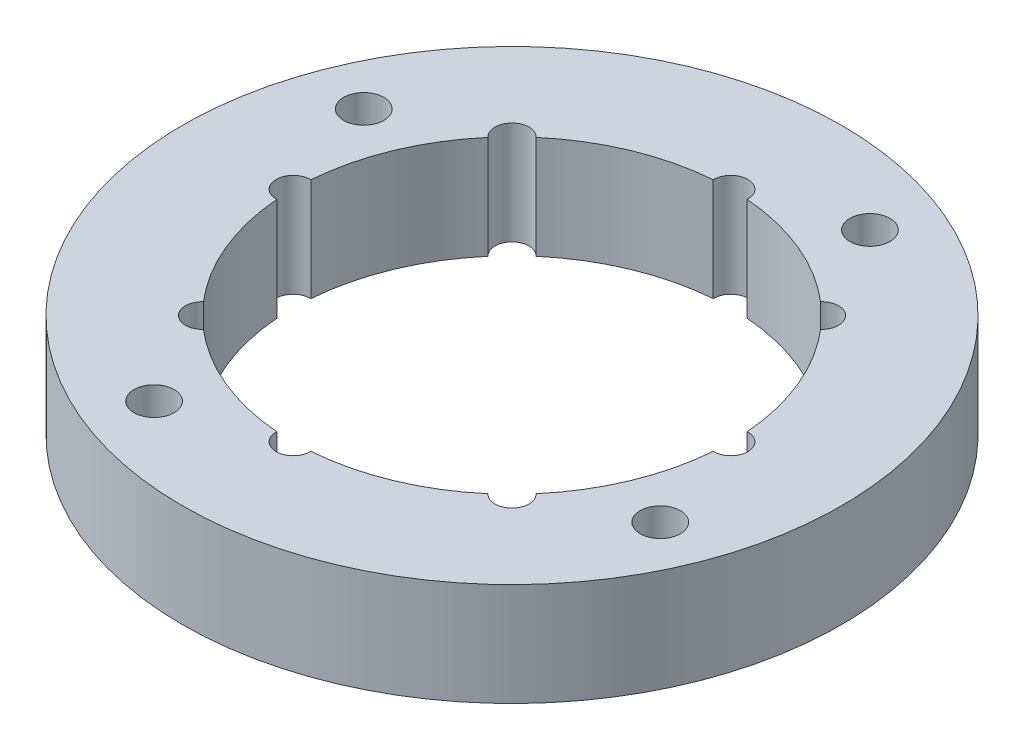
from build123d import *

# Parameters (mm, degrees)
F_1_5IN_SOCKET_R    = 40.64
F_1_5IN_SOCKET_R_2  = 2.475
BOSS_EXTRUDE1_DEPTH = 12.7


with BuildPart() as part:
    # 1.5in Socket → Boss-Extrude1 (new body)
    with BuildSketch(Plane(origin=(0, 0, 0), x_dir=(1, 0, 0), z_dir=(0, 1, 0))):
        Circle(F_1_5IN_SOCKET_R)
        with Locations((-12.927811712, -31.210498367)):
            Circle(F_1_5IN_SOCKET_R_2, mode=Mode.SUBTRACT)
        with BuildLine():
            ThreePointArc((-17.544892644, 20.506142942), (-10.327669131, 24.933198884), (-2.093920166, 26.906145294))
            ThreePointArc((-2.093920166, 26.906145294), (0, 29.083), (2.093920166, 26.906145294))
            ThreePointArc((2.093920166, 26.906145294), (10.327669131, 24.933198884), (17.544892644, 20.506142942))
            ThreePointArc((17.544892644, 20.506142942), (20.564786517, 20.564786517), (20.506142942, 17.544892644))
            ThreePointArc((20.506142942, 17.544892644), (24.933198884, 10.327669131), (26.906145294, 2.093920166))
            ThreePointArc((26.906145294, 2.093920166), (29.083, 0), (26.906145294, -2.093920166))
            ThreePointArc((26.906145294, -2.093920166), (24.933198884, -10.327669131), (20.506142942, -17.544892644))
            ThreePointArc((20.506142942, -17.544892644), (20.564786517, -20.564786517), (17.544892644, -20.506142942))
            ThreePointArc((17.544892644, -20.506142942), (10.327669131, -24.933198884), (2.093920166, -26.906145294))
            ThreePointArc((2.093920166, -26.906145294), (0, -29.083), (-2.093920166, -26.906145294))
            ThreePointArc((-2.093920166, -26.906145294), (-10.327669131, -24.933198884), (-17.544892644, -20.506142942))
            ThreePointArc((-17.544892644, -20.506142942), (-20.564786517, -20.564786517), (-20.506142942, -17.544892644))
            ThreePointArc((-20.506142942, -17.544892644), (-24.933198884, -10.327669131), (-26.906145294, -2.093920166))
            ThreePointArc((-26.906145294, -2.093920166), (-29.083, 0), (-26.906145294, 2.093920166))
            ThreePointArc((-26.906145294, 2.093920166), (-24.933198884, 10.327669131), (-20.506142942, 17.544892644))
            ThreePointArc((-20.506142942, 17.544892644), (-20.564786517, 20.564786517), (-17.544892644, 20.506142942))
        make_face(mode=Mode.SUBTRACT)
        with Locations((31.210498367, -12.927811712)):
            Circle(F_1_5IN_SOCKET_R_2, mode=Mode.SUBTRACT)
        with Locations((-31.210498367, 12.927811712)):
            Circle(F_1_5IN_SOCKET_R_2, mode=Mode.SUBTRACT)
        with Locations((12.927811712, 31.210498367)):
            Circle(F_1_5IN_SOCKET_R_2, mode=Mode.SUBTRACT)
    extrude(amount=BOSS_EXTRUDE1_DEPTH)


solid = part.part
